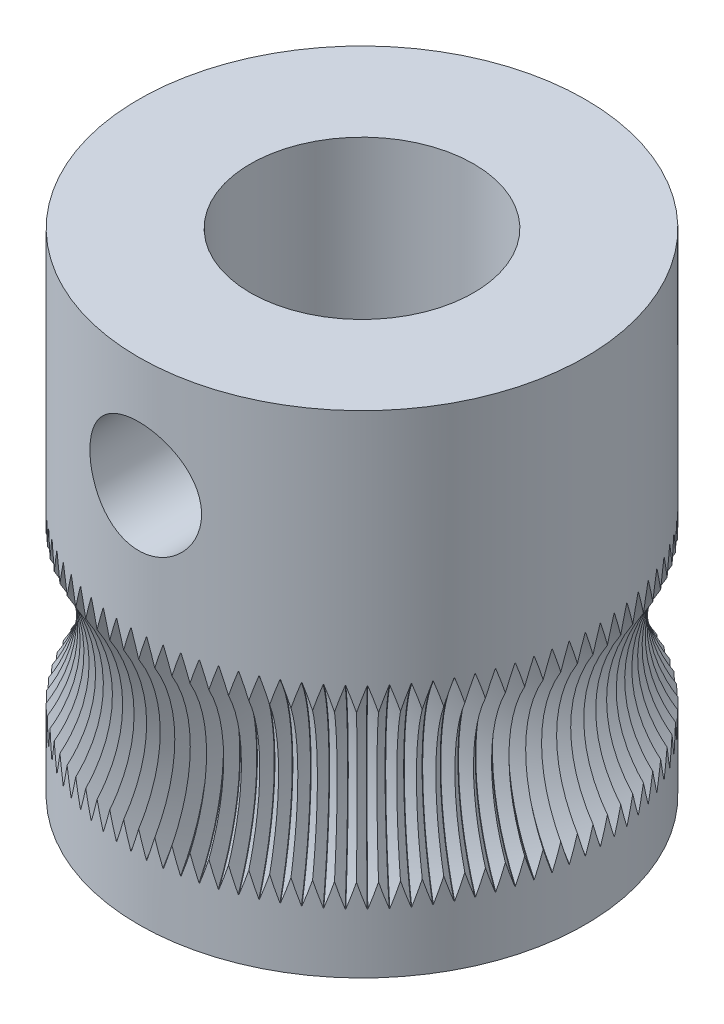
from build123d import *

# Parameters (mm, degrees)
SKETCH1_R              = 5
SKETCH1_R_2            = 2.5
BOSS_EXTRUDE1_DEPTH    = 11
M3_TAPPED_HOLE1_REACH  = 17.684
M3_TAPPED_HOLE1_BORE_R = 1.25
CIRPATTERN1_COUNT      = 90


with BuildPart() as part:
    # Sketch1 → Boss-Extrude1 (new body)
    with BuildSketch(Plane(origin=(0, 0, 0), x_dir=(1, 0, 0), z_dir=(0, 1, 0))):
        with Locations(Location((0, 0, 0), (0, 0, 270))):
            Circle(SKETCH1_R)
        with Locations(Location((0, 0, 0), (0, 0, 270))):
            Circle(SKETCH1_R_2, mode=Mode.SUBTRACT)
    extrude(amount=BOSS_EXTRUDE1_DEPTH)

    # M3 Tapped Hole1 bore → M3 Tapped Hole1 (cut, up to next)
    with BuildSketch(Plane.XY.offset(5), mode=Mode.PRIVATE) as m3_tapped_hole1_sk1:
        with Locations((0, 8.5)):
            Circle(M3_TAPPED_HOLE1_BORE_R)
    m3_tapped_hole1_tool1 = extrude(m3_tapped_hole1_sk1.sketch, amount=-M3_TAPPED_HOLE1_REACH, mode=Mode.PRIVATE) & part.part
    add(m3_tapped_hole1_tool1.solids().sort_by_distance((0, 8.5, 5))[0], mode=Mode.SUBTRACT)

    # Cut-Sweep1: sweep along a path in Sketch8
    with BuildLine(Plane.XY) as cut_sweep1_path:
        CenterArc((7.75, 3.5), 3.5, 0, 360)
    # Sketch10 → Cut-Sweep1 (sweep, cut)
    with BuildSketch(Plane(origin=(7.75, 0, 0), x_dir=(0, 0, -1), z_dir=(1, 0, 0))):
        Polygon((-0.969651225, 5.329175067), (0.969651225, 5.329175067), (0.005, 7), (-0.005, 7), align=None)
    cut_sweep1 = sweep(path=cut_sweep1_path.line, mode=Mode.SUBTRACT)

    # CirPattern1: Cut-Sweep1 ×90 about axis
    cirpattern1_axis = Axis((0, 11, 0), (0, -1, 0))
    for i in range(1, CIRPATTERN1_COUNT):
        add(cut_sweep1.rotate(cirpattern1_axis, i * 360 / CIRPATTERN1_COUNT), mode=Mode.SUBTRACT)


solid = part.part
